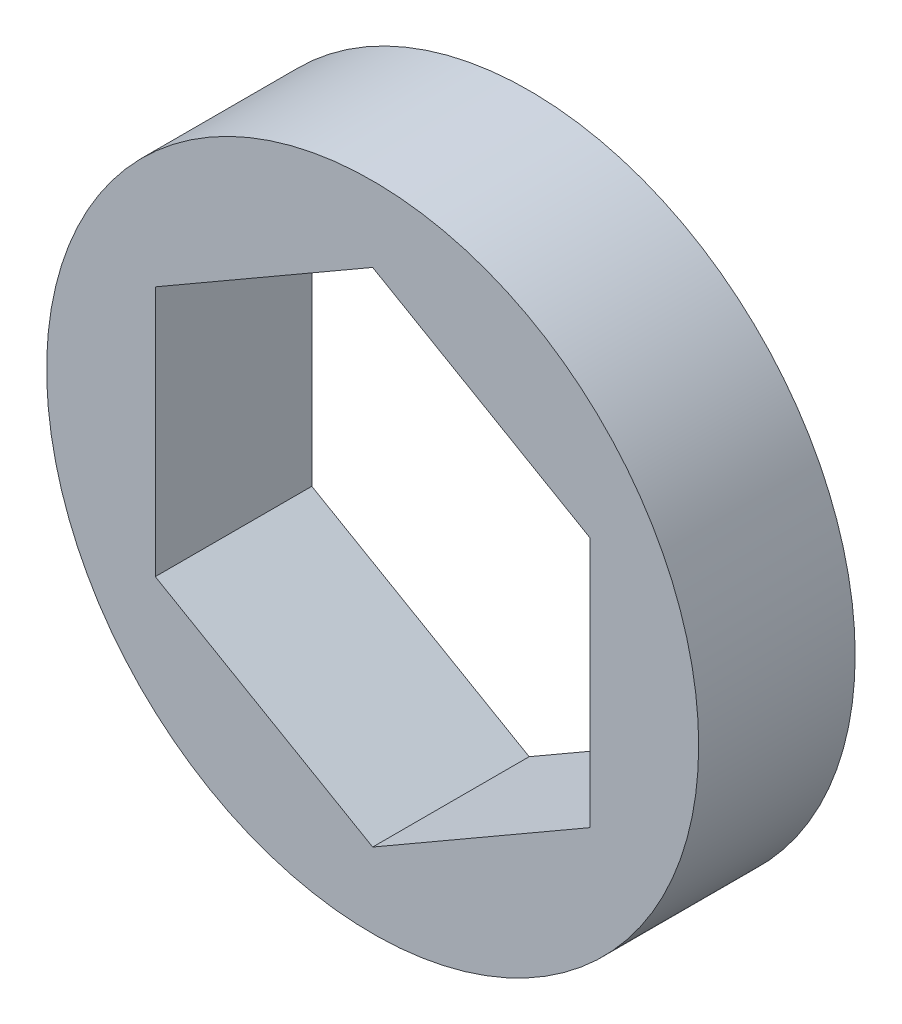
from build123d import *

# Parameters (mm, degrees)
SKETCH1_R           = 9.525
BOSS_EXTRUDE1_DEPTH = 4.572


with BuildPart() as part:
    # Sketch1 → Boss-Extrude1 (new body)
    with BuildSketch(Plane.XY):
        Circle(SKETCH1_R)
        Polygon((6.35, 3.666174209), (0, 7.332348419), (-6.35, 3.666174209), (-6.35, -3.666174209), (0, -7.332348419), (6.35, -3.666174209), align=None, mode=Mode.SUBTRACT)
    extrude(amount=BOSS_EXTRUDE1_DEPTH)


solid = part.part
